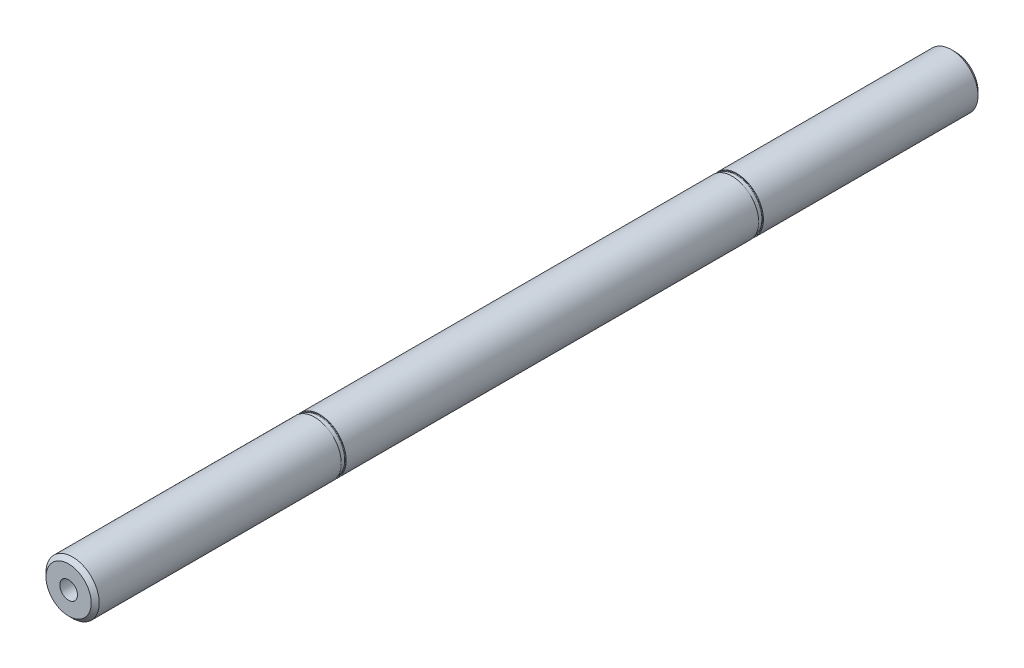
from build123d import *

# Parameters (mm, degrees)
SKETCH1_R           = 6
EXTRUDE1_DEPTH      = 100
CHAMFER1_SIZE       = 0.9
EXTRUDE3_DEPTH      = 101.359354322
EXTRUDE3_DEPTH_BACK = 101.359354322
SKETCH2_R           = 2


with BuildPart() as part:
    # Sketch1 → Extrude1 (new, symmetric)
    with BuildSketch(Plane.XY):
        Circle(SKETCH1_R)
    extrude(amount=EXTRUDE1_DEPTH, both=True)

    # Chamfer1
    chamfer1_edges = [part.edges().sort_by_distance(p)[0] for p in [
        (-6, 0, -100),
        (-6, 0, 100),
    ]]
    chamfer(chamfer1_edges, length=CHAMFER1_SIZE)

    # Sketch2 → Extrude3 (cut, two sides: drawn at the far end of the back side and taken through both)
    with BuildSketch(Plane.XY.offset(-EXTRUDE3_DEPTH_BACK)):
        Circle(SKETCH2_R)
    extrude(amount=EXTRUDE3_DEPTH + EXTRUDE3_DEPTH_BACK, mode=Mode.SUBTRACT)

    # Sketch5 → Groove for DIN 471 - 12 x 1_ Circlip for (revolve, cut)
    with BuildSketch(Plane(origin=(0, 0, 100), x_dir=(0, 1, 0), z_dir=(-1, 0, 0))):
        with BuildLine():
            Line((5.86, 55.5), (7.2, 55.5))
            Line((7.2, 55.5), (7.2, 56.6))
            Line((7.2, 56.6), (5.86, 56.6))
            ThreePointArc((5.86, 56.6), (5.782218254, 56.567781746), (5.75, 56.49))
            Line((5.75, 56.49), (5.75, 55.61))
            ThreePointArc((5.75, 55.61), (5.782218254, 55.532218254), (5.86, 55.5))
        make_face()
    revolve(axis=Axis((0, 0, 150), (0, 0, -1)), mode=Mode.SUBTRACT)

    # Sketch7 → Groove for DIN 471 - 12 x 1_ Circlip 2 (revolve, cut)
    with BuildSketch(Plane(origin=(0, 0, 100), x_dir=(0, 1, 0), z_dir=(-1, 0, 0))):
        with BuildLine():
            Line((5.899017031, 149.607152194), (7.198150102, 150.1))
            Line((7.198150102, 150.1), (7.2, 150.7))
            Line((7.2, 150.7), (5.86, 150.7))
            ThreePointArc((5.86, 150.7), (5.782218254, 150.667781746), (5.75, 150.59))
            Line((5.75, 150.59), (5.75, 149.71))
            ThreePointArc((5.75, 149.71), (5.797517496, 149.619468587), (5.899017031, 149.607152194))
        make_face()
    revolve(axis=Axis((0, 0, 150), (0, 0, -1)), mode=Mode.SUBTRACT)


solid = part.part
